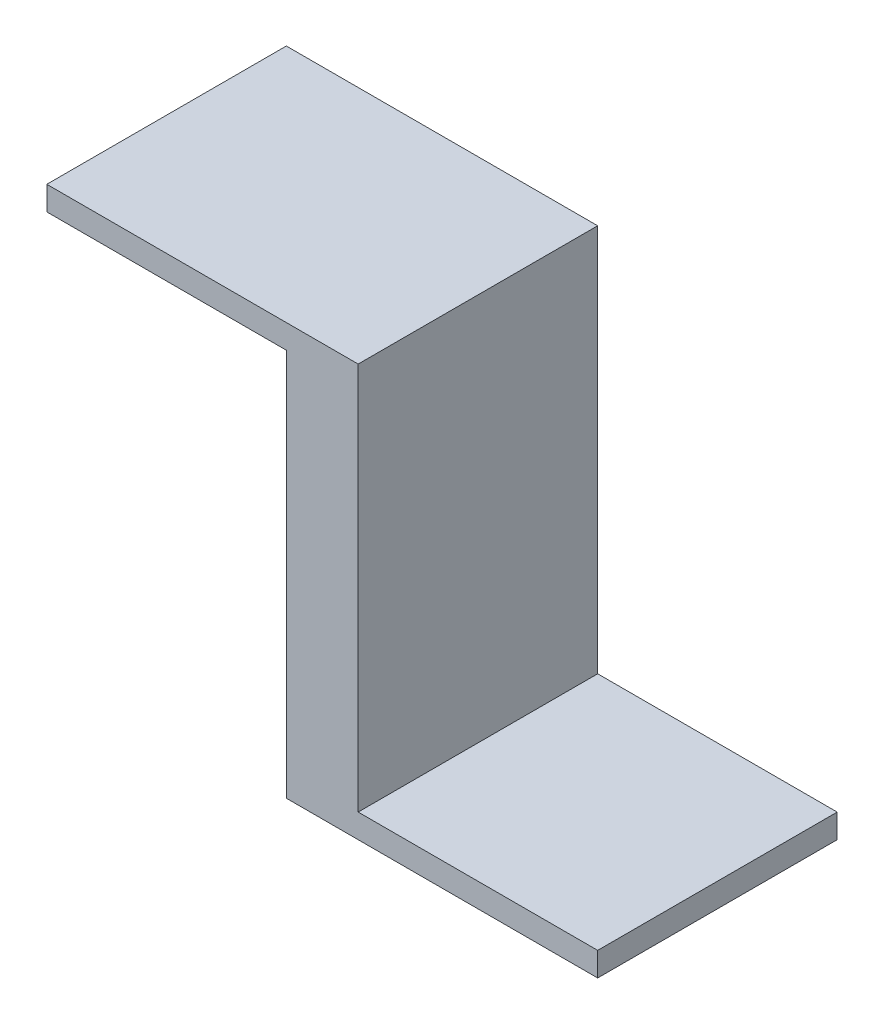
from build123d import *

# Parameters (mm, degrees)
BOSS_EXTRUDE1_DEPTH = 50


with BuildPart() as part:
    # Sketch1 → Boss-Extrude1 (new body)
    with BuildSketch(Plane.XY):
        Polygon((0, 0), (65, 0), (65, 5), (15, 5), (15, 86), (-50, 86), (-50, 81), (0, 81), align=None)
    extrude(amount=BOSS_EXTRUDE1_DEPTH)


solid = part.part
